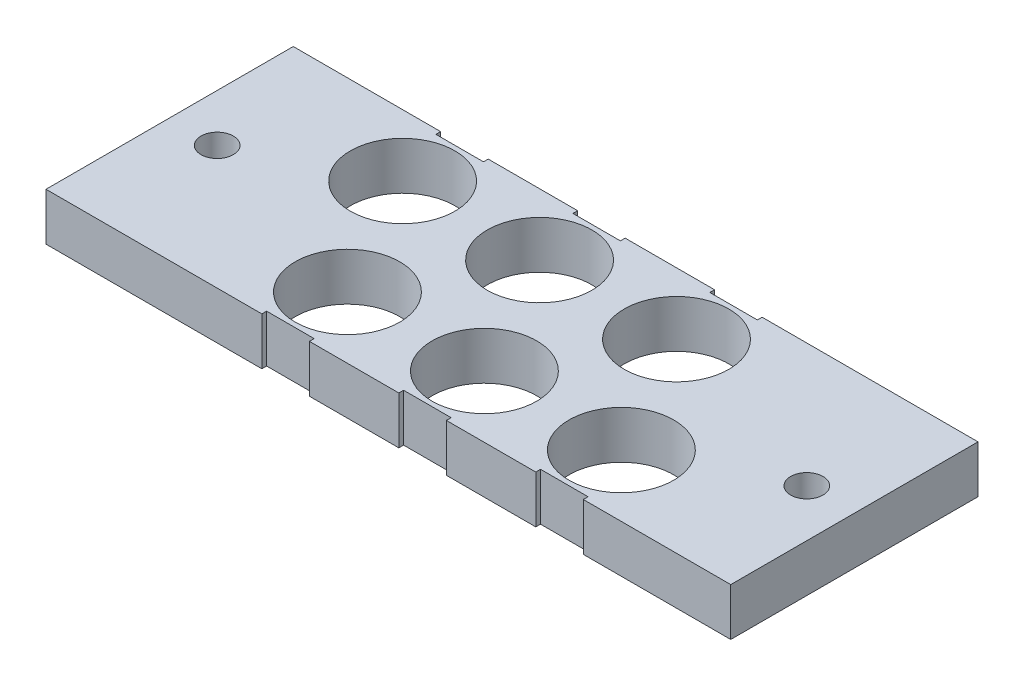
from build123d import *

# Parameters (mm, degrees)
SKETCH1_R             = 5.5
BOSS_EXTRUDE1_DEPTH   = 5
BOSS_EXTRUDE1_2_DEPTH = 5
BOSS_EXTRUDE1_3_DEPTH = 5
BOSS_EXTRUDE1_4_DEPTH = 5
BOSS_EXTRUDE1_5_DEPTH = 5
BOSS_EXTRUDE1_6_DEPTH = 5
SKETCH1_4_R           = 1.7
BOSS_EXTRUDE2_DEPTH   = 5
CUT_EXTRUDE2_DEPTH    = 1


with BuildPart() as part:
    # Sketch1 → Boss-Extrude1 (new body)
    with BuildSketch(Plane(origin=(0, 0, 0), x_dir=(1, 0, 0), z_dir=(0, 1, 0))):
        Polygon((5.686387511, -4.664883005), (-6.313612489, -4.664882988), (-6.313612506, -16.664882988), (5.686387494, -16.664883005), align=None)
        with Locations((-0.313612497, -10.664882997)):
            Circle(SKETCH1_R, mode=Mode.SUBTRACT)
    extrude(amount=-BOSS_EXTRUDE1_DEPTH)



with BuildPart() as body_2:
    # Sketch1 → Boss-Extrude1 2 (new body)
    with BuildSketch(Plane(origin=(0, 0, 0), x_dir=(1, 0, 0), z_dir=(0, 1, 0))):
        Polygon((20.086387511, -4.664883026), (8.086387511, -4.664883009), (8.086387494, -16.664883009), (20.086387494, -16.664883026), align=None)
        with Locations((14.086387503, -10.664883017)):
            Circle(SKETCH1_R, mode=Mode.SUBTRACT)
    extrude(amount=-BOSS_EXTRUDE1_2_DEPTH)


with BuildPart() as body_3:
    # Sketch1 → Boss-Extrude1 3 (new body)
    with BuildSketch(Plane(origin=(0, 0, 0), x_dir=(1, 0, 0), z_dir=(0, 1, 0))):
        Polygon((0.886387474, -29.664882999), (12.886387474, -29.664883016), (12.886387491, -17.664883016), (0.886387491, -17.664882999), align=None)
        with Locations((6.886387483, -23.664883007)):
            Circle(SKETCH1_R, mode=Mode.SUBTRACT)
    extrude(amount=-BOSS_EXTRUDE1_3_DEPTH)


with BuildPart() as body_4:
    # Sketch1 → Boss-Extrude1 4 (new body)
    with BuildSketch(Plane(origin=(0, 0, 0), x_dir=(1, 0, 0), z_dir=(0, 1, 0))):
        Polygon((15.286387474, -29.664883019), (27.286387474, -29.664883036), (27.286387491, -17.664883036), (15.286387491, -17.664883019), align=None)
        with Locations((21.286387483, -23.664883027)):
            Circle(SKETCH1_R, mode=Mode.SUBTRACT)
    extrude(amount=-BOSS_EXTRUDE1_4_DEPTH)


with BuildPart() as body_5:
    # Sketch1 → Boss-Extrude1 5 (new body)
    with BuildSketch(Plane(origin=(0, 0, 0), x_dir=(1, 0, 0), z_dir=(0, 1, 0))):
        Polygon((34.486387511, -4.664883046), (22.486387511, -4.664883029), (22.486387494, -16.664883029), (34.486387494, -16.664883046), align=None)
        with Locations((28.486387503, -10.664883038)):
            Circle(SKETCH1_R, mode=Mode.SUBTRACT)
    extrude(amount=-BOSS_EXTRUDE1_5_DEPTH)


with BuildPart() as body_6:
    # Sketch1 → Boss-Extrude1 6 (new body)
    with BuildSketch(Plane(origin=(0, 0, 0), x_dir=(1, 0, 0), z_dir=(0, 1, 0))):
        Polygon((29.686387474, -29.664883039), (41.686387474, -29.664883056), (41.686387491, -17.664883056), (29.686387491, -17.664883039), align=None)
        with Locations((35.686387483, -23.664883048)):
            Circle(SKETCH1_R, mode=Mode.SUBTRACT)
    extrude(amount=-BOSS_EXTRUDE1_6_DEPTH)


with BuildPart() as part_1:
    add(part.part)

    add(body_2.part)  # Boss-Extrude2 merges body 2

    add(body_3.part)  # Boss-Extrude2 merges body 3

    add(body_4.part)  # Boss-Extrude2 merges body 4

    add(body_5.part)  # Boss-Extrude2 merges body 5

    add(body_6.part)  # Boss-Extrude2 merges body 6
    # Sketch1<4> → Boss-Extrude2 (add)
    with BuildSketch(Plane(origin=(0, 0, 0), x_dir=(1, 0, 0), z_dir=(0, 1, 0))):
        Polygon((7.586387521, -4.164883013), (2.186387512, -4.164883), (2.186387511, -4.664883), (5.686387511, -4.664883005), (5.686387494, -16.664883005), (-6.313612506, -16.664882988), (-6.313612489, -4.664882988), (-2.813612489, -4.664882993), (-2.813612488, -4.164882993), (-6.813612488, -4.164882988), (-18.31361246, -4.164883002), (-18.31361246, -30.164883012), (0.386387502, -30.164883012), (4.386387474, -30.164883004), (4.386387474, -29.664883004), (0.886387474, -29.664882999), (0.886387491, -17.664882999), (12.886387491, -17.664883016), (12.886387474, -29.664883016), (9.386387474, -29.664883011), (9.386387474, -30.164883011), (13.386387474, -30.164883016), (14.786387502, -30.164883033), (18.786387474, -30.164883024), (18.786387474, -29.664883024), (15.286387474, -29.664883019), (15.286387491, -17.664883019), (27.286387491, -17.664883036), (27.286387474, -29.664883036), (23.786387474, -29.664883031), (23.786387474, -30.164883031), (27.786387474, -30.164883037), (29.186387502, -30.164883053), (33.186387474, -30.164883044), (33.186387474, -29.664883044), (29.686387474, -29.664883039), (29.686387491, -17.664883039), (41.686387491, -17.664883056), (41.686387474, -29.664883056), (38.186387474, -29.664883051), (38.186387474, -30.164883051), (42.186387474, -30.164883057), (53.686387503, -30.164883012), (53.686387503, -4.164883002), (34.98638754, -4.164883061), (30.986387512, -4.164883041), (30.986387511, -4.664883041), (34.486387511, -4.664883046), (34.486387494, -16.664883046), (22.486387494, -16.664883029), (22.486387511, -4.664883029), (25.986387511, -4.664883034), (25.986387512, -4.164883034), (21.986387512, -4.164883028), (20.58638754, -4.164883041), (16.586387512, -4.164883021), (16.586387511, -4.664883021), (20.086387511, -4.664883026), (20.086387494, -16.664883026), (8.086387494, -16.664883009), (8.086387511, -4.664883009), (11.586387511, -4.664883014), (11.586387512, -4.164883014), align=None)
        with Locations((-13.31361246, -17.164883007)):
            Circle(SKETCH1_4_R, mode=Mode.SUBTRACT)
        with Locations((48.68638754, -17.164883007)):
            Circle(SKETCH1_4_R, mode=Mode.SUBTRACT)
    extrude(amount=-BOSS_EXTRUDE2_DEPTH)

    # Sketch4 → Cut-Extrude2 (cut)
    with BuildSketch(Plane.XZ.offset(5)):
        Polygon((-9.718963701, 26.127659521), (-8.172168829, 26.127659521), (-8.172168829, 25.802018495), (-9.434027803, 25.802018495), (-9.434027803, 24.825095419), (-8.172168829, 24.825095419), (-8.172168829, 24.499454393), (-9.434027803, 24.499454393), (-9.434027803, 22.952659521), (-9.718963701, 22.952659521), align=None)
        Polygon((-7.212418228, 26.127659521), (-6.625373957, 26.127659521), (-6.625373957, 22.952659521), (-6.910309854, 22.952659521), (-6.910309854, 25.802018495), (-7.398771393, 25.802018495), align=None)
    extrude(amount=-CUT_EXTRUDE2_DEPTH, mode=Mode.SUBTRACT)


solid = part_1.part
